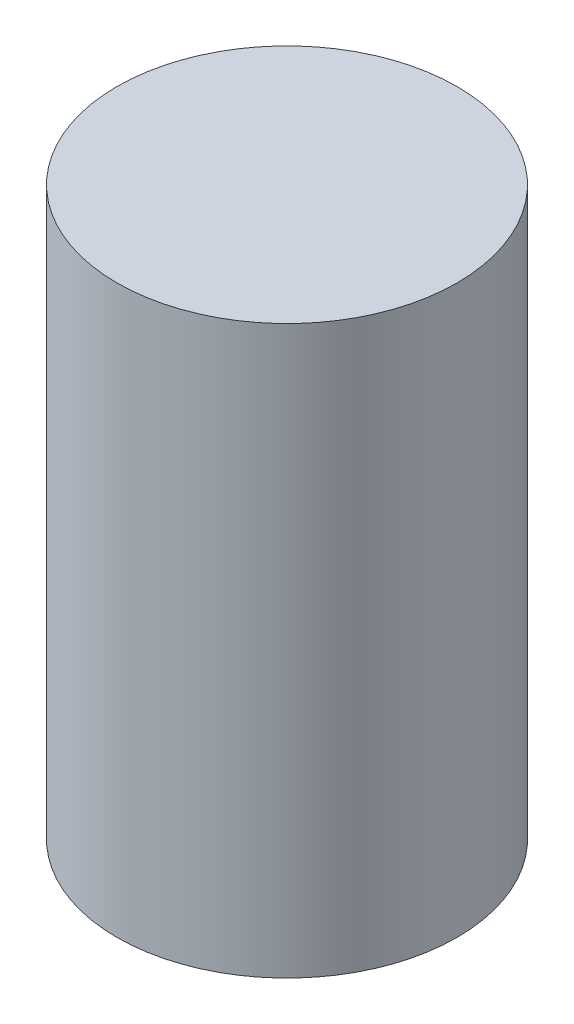
from build123d import *

# Parameters (mm, degrees)
SKETCH_1_R      = 300
EXTRUDE_1_DEPTH = 1000


with BuildPart() as part:
    # 草图1 → 凸台-拉伸1 (new body)
    with BuildSketch(Plane(origin=(0, 0, 0), x_dir=(1, 0, 0), z_dir=(0, 1, 0))):
        Circle(SKETCH_1_R)
    extrude(amount=EXTRUDE_1_DEPTH)


solid = part.part
